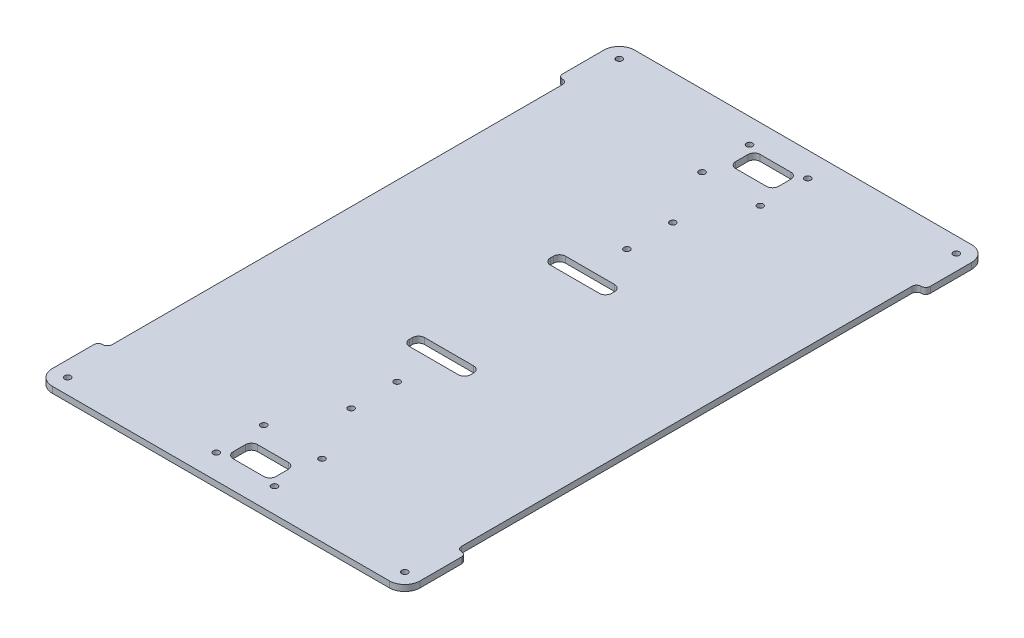
from build123d import *

# Parameters (mm, degrees)
ESBO_O1_W                = 120
ESBO_O1_H                = 190
RESSALTO_EXTRUS_O1_DEPTH = 2
ESBO_O2_R                = 1
CORTE_EXTRUS_O1_DEPTH    = 10
ESBO_O3_R                = 1
CORTE_EXTRUS_O2_DEPTH    = 113.378823628
FILETE1_R                = 5
ESBO_O4_W                = 3
ESBO_O4_H                = 150
CORTE_EXTRUS_O3_DEPTH    = 113.378823628
FILETE2_R                = 1.5
CORTE_EXTRUS_O4_DEPTH    = 10
ESBO_O6_R                = 1
CORTE_EXTRUS_O5_DEPTH    = 10


with BuildPart() as part:
    # Esboço1 → Ressalto-extrusão1 (new body)
    with BuildSketch(Plane(origin=(0, 0, 0), x_dir=(1, 0, 0), z_dir=(0, 1, 0))):
        Rectangle(ESBO_O1_W, ESBO_O1_H)
    extrude(amount=RESSALTO_EXTRUS_O1_DEPTH)

    # Esboço2 → Corte-extrusão1 (cut)
    with BuildSketch(Plane(origin=(0, 2, 0), x_dir=(1, 0, 0), z_dir=(0, 1, 0))):
        with Locations(Location((0, -37.5, 0), (0, 0, 270))):
            Circle(ESBO_O2_R)
        with Locations(Location((0, -52.5, 0), (0, 0, 90))):
            Circle(ESBO_O2_R)
        with Locations(Location((0, 52.5, 0), (0, 0, 270))):
            Circle(ESBO_O2_R)
        with Locations(Location((0, 37.5, 0), (0, 0, 90))):
            Circle(ESBO_O2_R)
    extrude(amount=-CORTE_EXTRUS_O1_DEPTH, mode=Mode.SUBTRACT)

    # Esboço3 → Corte-extrusão2 (cut, through all)
    with BuildSketch(Plane(origin=(0, 2, 0), x_dir=(1, 0, 0), z_dir=(0, 1, 0))):
        with Locations(Location((-55, 90, 0), (0, 0, 270))):
            Circle(ESBO_O3_R)
        with Locations(Location((55, 90, 0), (0, 0, 90))):
            Circle(ESBO_O3_R)
        with Locations(Location((55, -90, 0), (0, 0, 270))):
            Circle(ESBO_O3_R)
        with Locations(Location((-55, -90, 0), (0, 0, 90))):
            Circle(ESBO_O3_R)
    extrude(amount=-CORTE_EXTRUS_O2_DEPTH, mode=Mode.SUBTRACT)

    # Filete1
    filete1_edges = [part.edges().sort_by_distance(p)[0] for p in [
        (60, 1, 95),
        (-60, 1, 95),
        (-60, 1, -95),
        (60, 1, -95),
    ]]
    fillet(filete1_edges, radius=FILETE1_R)

    # Esboço4 → Corte-extrusão3 (cut, through all)
    with BuildSketch(Plane(origin=(0, 2, 0), x_dir=(1, 0, 0), z_dir=(0, 1, 0))):
        with Locations((58.5, 0)):
            Rectangle(ESBO_O4_W, ESBO_O4_H)
    corte_extrus_o3 = extrude(amount=-CORTE_EXTRUS_O3_DEPTH, mode=Mode.SUBTRACT)

    # Espelhar1: Corte-extrusão3 across plane
    add(corte_extrus_o3.mirror(Plane(origin=(0, 0, 0), x_dir=(0, 0, 1), z_dir=(1, 0, 0))), mode=Mode.SUBTRACT)

    # Filete2
    filete2_edges = [part.edges().sort_by_distance(p)[0] for p in [
        (57, 1, 75),
        (57, 1, -75),
        (-57, 1, 75),
        (-57, 1, -75),
    ]]
    fillet(filete2_edges, radius=FILETE2_R)
    filete2_2_edges = [part.edges().sort_by_distance(p)[0] for p in [
        (60, 1, 75),
        (60, 1, -75),
        (-60, 1, 75),
        (-60, 1, -75),
    ]]
    fillet(filete2_2_edges, radius=FILETE2_R - 0.0001)  # a hair under: the kernel refuses the full size

    # Esboço5 → Corte-extrusão4 (cut)
    with BuildSketch(Plane.XZ):
        with BuildLine():
            Line((-8, 25.5), (8, 25.5))
            ThreePointArc((8, 25.5), (9.414213562, 24.914213562), (10, 23.5))
            Line((10, 23.5), (10, 22.5))
            ThreePointArc((10, 22.5), (9.414213562, 21.085786438), (8, 20.5))
            Line((8, 20.5), (-8, 20.5))
            ThreePointArc((-8, 20.5), (-9.414213562, 21.085786438), (-10, 22.5))
            Line((-10, 22.5), (-10, 23.5))
            ThreePointArc((-10, 23.5), (-9.414213562, 24.914213562), (-8, 25.5))
        make_face()
        with BuildLine():
            Line((10, -23.5), (10, -22.5))
            ThreePointArc((10, -22.5), (9.414213562, -21.085786438), (8, -20.5))
            Line((8, -20.5), (-8, -20.5))
            ThreePointArc((-8, -20.5), (-9.414213562, -21.085786438), (-10, -22.5))
            Line((-10, -22.5), (-10, -23.5))
            ThreePointArc((-10, -23.5), (-9.414213562, -24.914213562), (-8, -25.5))
            Line((-8, -25.5), (8, -25.5))
            ThreePointArc((8, -25.5), (9.414213562, -24.914213562), (10, -23.5))
        make_face()
    extrude(amount=-CORTE_EXTRUS_O4_DEPTH, mode=Mode.SUBTRACT)

    # Esboço6 → Corte-extrusão5 (cut)
    with BuildSketch(Plane.XZ):
        with Locations(Location((9.5, 87, 0), (0, 0, 270))):
            Circle(ESBO_O6_R)
        with Locations(Location((9.5, 71.5, 0), (0, 0, 270))):
            Circle(ESBO_O6_R)
        with Locations(Location((-9.5, 87, 0), (0, 0, 270))):
            Circle(ESBO_O6_R)
        with Locations(Location((-9.5, 71.5, 0), (0, 0, 270))):
            Circle(ESBO_O6_R)
        with BuildLine():
            Line((-5, 86), (5, 86))
            ThreePointArc((5, 86), (6.414213562, 85.414213562), (7, 84))
            Line((7, 84), (7, 80))
            ThreePointArc((7, 80), (6.414213562, 78.585786438), (5, 78))
            Line((5, 78), (-5, 78))
            ThreePointArc((-5, 78), (-6.414213562, 78.585786438), (-7, 80))
            Line((-7, 80), (-7, 84))
            ThreePointArc((-7, 84), (-6.414213562, 85.414213562), (-5, 86))
        make_face()
    corte_extrus_o5 = extrude(amount=-CORTE_EXTRUS_O5_DEPTH, mode=Mode.SUBTRACT)

    # Espelhar2: Corte-extrusão5 across plane
    add(corte_extrus_o5.mirror(Plane.XY), mode=Mode.SUBTRACT)


solid = part.part
